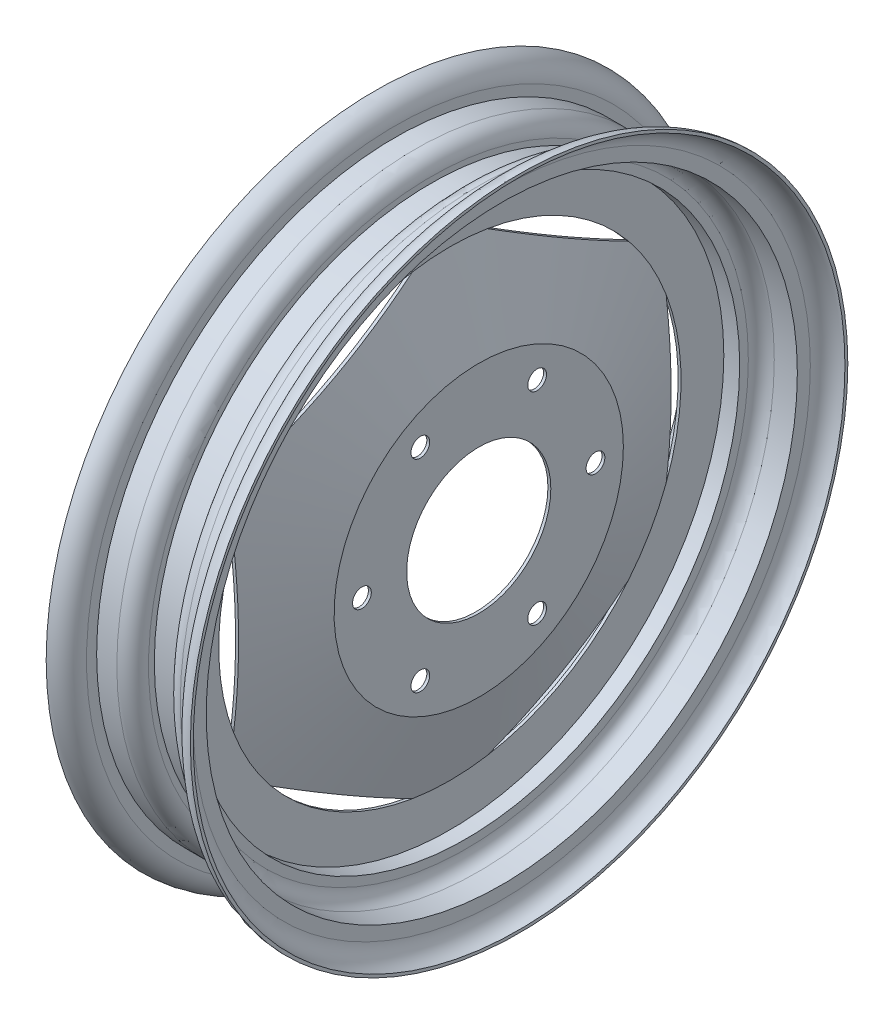
from build123d import *

# Parameters (mm, degrees)
CUT_EXTRUDE5_DEPTH = 188
SKETCH3_R          = 6.5
CUT_EXTRUDE6_DEPTH = 188
CIRPATTERN2_COUNT  = 6


# Read off the part's stored shape, not the designer's step: Thicken1, Thicken2
with BuildPart() as part:
    # Thicken1 outline → Thicken1 (revolve)
    with BuildSketch(Plane.YX):
        Polygon((160, 0), (190, 0), (190, 2), (160.32455532, 2), (100.32455532, 22), (50, 22), (50, 20), (100, 20), align=None)
    revolve(axis=Axis((0, 0, 0), (1, 0, 0)))

    # Thicken2 outline → Thicken2 (revolve)
    with BuildSketch(Plane.YX):
        with BuildLine():
            Line((190, -13), (196, -13))
            ThreePointArc((196, -13), (202.363961031, -15.636038969), (205, -22))
            Line((205, -22), (205, -38))
            Line((205, -38), (214, -38))
            ThreePointArc((214, -38), (222.485281374, -41.514718626), (226, -50))
            Line((226, -50), (228, -50))
            ThreePointArc((228, -50), (223.899494937, -40.100505063), (214, -36))
            Line((214, -36), (207, -36))
            Line((207, -36), (207, -22))
            ThreePointArc((207, -22), (203.778174593, -14.221825407), (196, -11))
            Line((196, -11), (192, -11))
            Line((192, -11), (192, 11))
            Line((192, 11), (196, 11))
            ThreePointArc((196, 11), (203.778174593, 14.221825407), (207, 22))
            Line((207, 22), (207, 36))
            Line((207, 36), (214, 36))
            ThreePointArc((214, 36), (223.899494937, 40.100505063), (228, 50))
            Line((228, 50), (226, 50))
            ThreePointArc((226, 50), (222.485281374, 41.514718626), (214, 38))
            Line((214, 38), (205, 38))
            Line((205, 38), (205, 22))
            ThreePointArc((205, 22), (202.363961031, 15.636038969), (196, 13))
            Line((196, 13), (190, 13))
            Line((190, 13), (190, -13))
        make_face()
    revolve(axis=Axis((0, 0, 0), (1, 0, 0)))

    # Sketch2 → Cut-Extrude5 (cut, symmetric)
    with BuildSketch(Plane(origin=(22, 0, 0), x_dir=(0, 0, -1), z_dir=(1, 0, 0))):
        with BuildLine():
            ThreePointArc((-150, 56.6035603), (-160.32455532, 0), (-150, -56.6035603))
            Line((-150, -56.6035603), (-150, 56.6035603))
        make_face()
    cut_extrude5 = extrude(amount=CUT_EXTRUDE5_DEPTH, both=True, mode=Mode.SUBTRACT)

    # Sketch3 → Cut-Extrude6 (cut)
    with BuildSketch(Plane(origin=(22, 0, 0), x_dir=(0, 0, -1), z_dir=(1, 0, 0))):
        with Locations((-81, 0)):
            Circle(SKETCH3_R)
    cut_extrude6 = extrude(amount=-CUT_EXTRUDE6_DEPTH, mode=Mode.SUBTRACT)

    # CirPattern2: Cut-Extrude5, Cut-Extrude6 ×6 about axis
    cirpattern2_axis = Axis((0, 0, 0), (1, 0, 0))
    add([cut_extrude5.rotate(cirpattern2_axis, i * 360 / CIRPATTERN2_COUNT) for i in range(1, CIRPATTERN2_COUNT)], mode=Mode.SUBTRACT)
    add([cut_extrude6.rotate(cirpattern2_axis, i * 360 / CIRPATTERN2_COUNT) for i in range(1, CIRPATTERN2_COUNT)], mode=Mode.SUBTRACT)


solid = part.part
